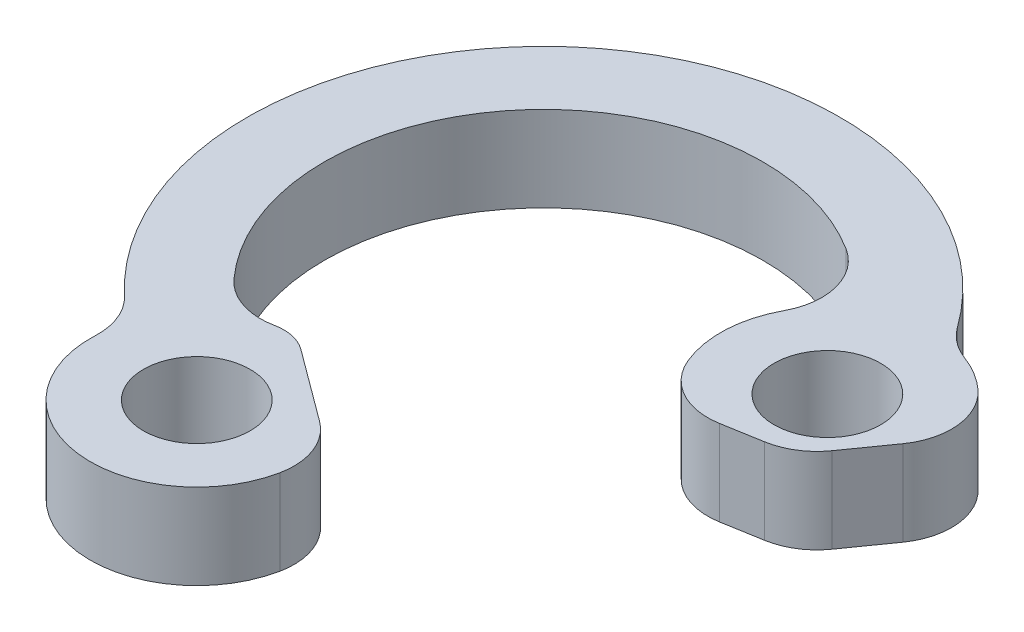
from build123d import *

# Parameters (mm, degrees)
SKETCH2_R           = 2.5
BOSS_EXTRUDE1_DEPTH = 4
FILLET1_R           = 3
CUT_EXTRUDE2_DEPTH  = 7
FILLET2_R           = 3
FILLET3_R           = 2
CUT_EXTRUDE3_DEPTH  = 4
FILLET4_R           = 3
CUT_EXTRUDE4_DEPTH  = 5
FILLET5_R           = 3


with BuildPart() as part:
    # Sketch2 → Boss-Extrude1 (new body)
    with BuildSketch(Plane(origin=(0, 0, 0), x_dir=(1, 0, 0), z_dir=(0, 1, 0))):
        with BuildLine():
            ThreePointArc((70.082441242, 70.375471459), (68.701032678, 85.785425288), (84.157953122, 85.10824213))
            ThreePointArc((84.157953122, 85.10824213), (88.169530247, 76.167900978), (87.971523368, 85.965004847))
            ThreePointArc((87.971523368, 85.965004847), (66.773130519, 88.957801307), (67.785886209, 67.573156911))
            ThreePointArc((67.785886209, 67.573156911), (76.405902982, 62.851068524), (70.082441242, 70.375471459))
        make_face()
        with Locations((72.538655529, 66.020358214)):
            Circle(SKETCH2_R, mode=Mode.SUBTRACT)
        with Locations((87.073540725, 81.04630307)):
            Circle(SKETCH2_R, mode=Mode.SUBTRACT)
    extrude(amount=BOSS_EXTRUDE1_DEPTH)

    # Fillet1
    fillet1_edges = [part.edges().sort_by_distance(p)[0] for p in [
        (67.785886209, 2, -67.573156911),
        (70.082441242, 2, -70.375471459),
        (84.157953122, 2, -85.10824213),
        (87.971523368, 2, -85.965004847),
    ]]
    fillet(fillet1_edges, radius=FILLET1_R)

    # Sketch4 → Cut-Extrude2 (cut)
    with BuildSketch(Plane(origin=(0, 0, 0), x_dir=(-1, 0, 0), z_dir=(0, -1, 0))):
        Polygon((-78.063653069, 66.716653157), (-72.1449642, 71.091471725), (-73.077184563, 72.352671977), (-78.995873431, 67.977853409), align=None)
    extrude(amount=-CUT_EXTRUDE2_DEPTH, mode=Mode.SUBTRACT)

    # Fillet2
    fillet2_edges = [part.edges().sort_by_distance(p)[0] for p in [
        (77.394817884, 2, -67.211024909),
    ]]
    fillet(fillet2_edges, radius=FILLET2_R)

    # Fillet3
    fillet3_edges = [part.edges().sort_by_distance(p)[0] for p in [
        (72.252278132, 2, -71.012150275),
    ]]
    fillet(fillet3_edges, radius=FILLET3_R)

    # Sketch5 → Cut-Extrude3 (cut)
    with BuildSketch(Plane(origin=(0, 4, 0), x_dir=(1, 0, 0), z_dir=(0, 1, 0))):
        Polygon((91.915683274, 82.292760262), (87.509474915, 76.065343184), (89.248604191, 74.615528375), (94.045863103, 81.084803637), align=None)
    extrude(amount=-CUT_EXTRUDE3_DEPTH, mode=Mode.SUBTRACT)

    # Fillet4
    fillet4_edges = [part.edges().sort_by_distance(p)[0] for p in [
        (87.509474915, 2, -76.065343184),
        (91.915683274, 2, -82.292760262),
    ]]
    fillet(fillet4_edges, radius=FILLET4_R)

    # Sketch6 → Cut-Extrude4 (cut)
    with BuildSketch(Plane(origin=(0, 4, 0), x_dir=(1, 0, 0), z_dir=(0, 1, 0))):
        Polygon((88.770033289, 77.846925466), (84.083019815, 77.039211271), (84.659332186, 75.34612768), (89.090596179, 75.986759337), align=None)
    extrude(amount=-CUT_EXTRUDE4_DEPTH, mode=Mode.SUBTRACT)

    # Fillet5
    fillet5_edges = [part.edges().sort_by_distance(p)[0] for p in [
        (84.083019815, 2, -77.039211271),
        (88.770033289, 2, -77.846925466),
    ]]
    fillet(fillet5_edges, radius=FILLET5_R)


solid = part.part
